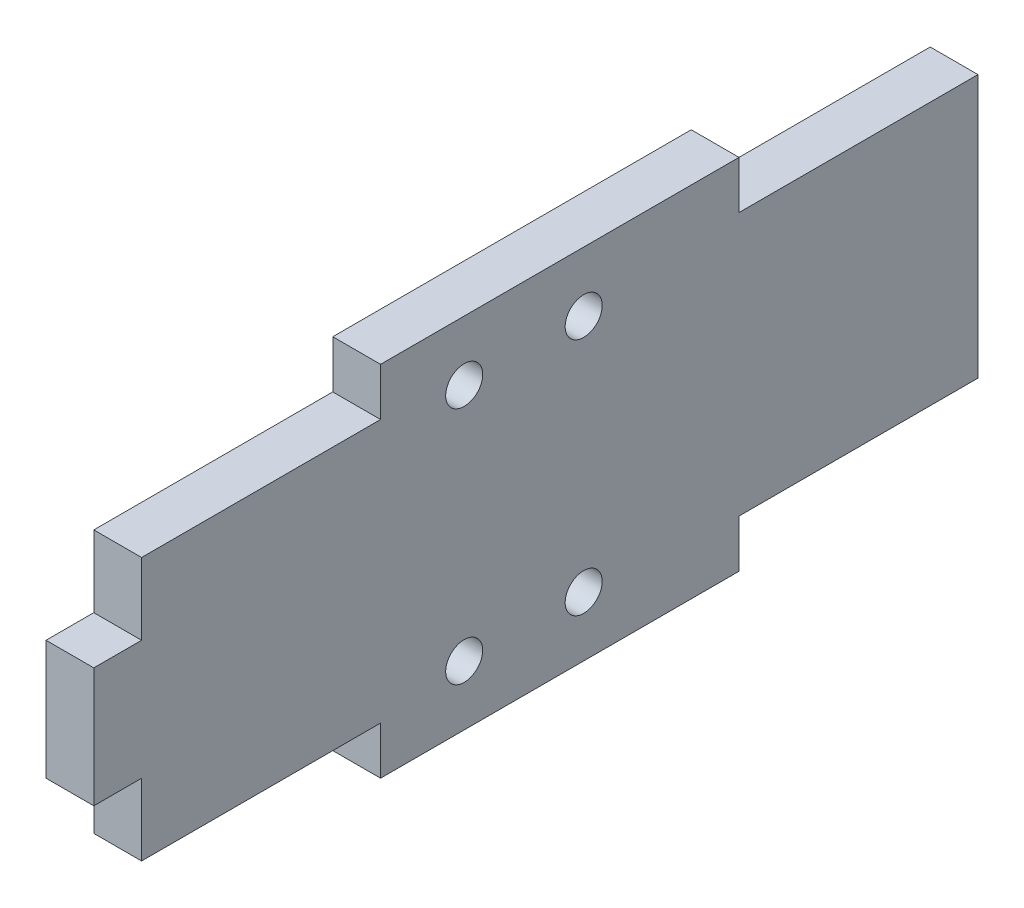
from build123d import *

# Parameters (mm, degrees)
AUFSATZ_LINEAR_AUSTRAGEN1_DEPTH = 4
SKIZZE2_W                       = 20
SKIZZE2_H                       = 4
SCHNITT_LINEAR_AUSTRAGEN1_DEPTH = 76.610845783
SKIZZE4_R                       = 1.55
SCHNITT_LINEAR_AUSTRAGEN3_DEPTH = 10


with BuildPart() as part:
    # Skizze1 → Aufsatz-Linear austragen1 (new body)
    with BuildSketch(Plane(origin=(0, 0, 0), x_dir=(0, 0, -1), z_dir=(1, 0, 0))):
        Polygon((0, -5), (0, 5), (4, 5), (4, 15), (74, 15), (74, -15), (4, -15), (4, -5), align=None)
    extrude(amount=AUFSATZ_LINEAR_AUSTRAGEN1_DEPTH)

    # Skizze2 → Schnitt-Linear austragen1 (cut, through all)
    with BuildSketch(Plane(origin=(4, 0, 0), x_dir=(0, 0, -1), z_dir=(1, 0, 0))):
        with Locations((14, 13)):
            Rectangle(SKIZZE2_W, SKIZZE2_H)
        with Locations((64, 13)):
            Rectangle(SKIZZE2_W, SKIZZE2_H)
        with Locations((64, -13)):
            Rectangle(SKIZZE2_W, SKIZZE2_H)
        with Locations((14, -13)):
            Rectangle(SKIZZE2_W, SKIZZE2_H)
    extrude(amount=-SCHNITT_LINEAR_AUSTRAGEN1_DEPTH, mode=Mode.SUBTRACT)

    # Skizze4 → Schnitt-Linear austragen3 (cut)
    with BuildSketch(Plane(origin=(4, 0, 0), x_dir=(0, 0, -1), z_dir=(1, 0, 0))):
        with Locations((41, 10)):
            Circle(SKIZZE4_R)
        with Locations((31, 10)):
            Circle(SKIZZE4_R)
        with Locations((31, -10)):
            Circle(SKIZZE4_R)
        with Locations((41, -10)):
            Circle(SKIZZE4_R)
    extrude(amount=-SCHNITT_LINEAR_AUSTRAGEN3_DEPTH, mode=Mode.SUBTRACT)


solid = part.part
